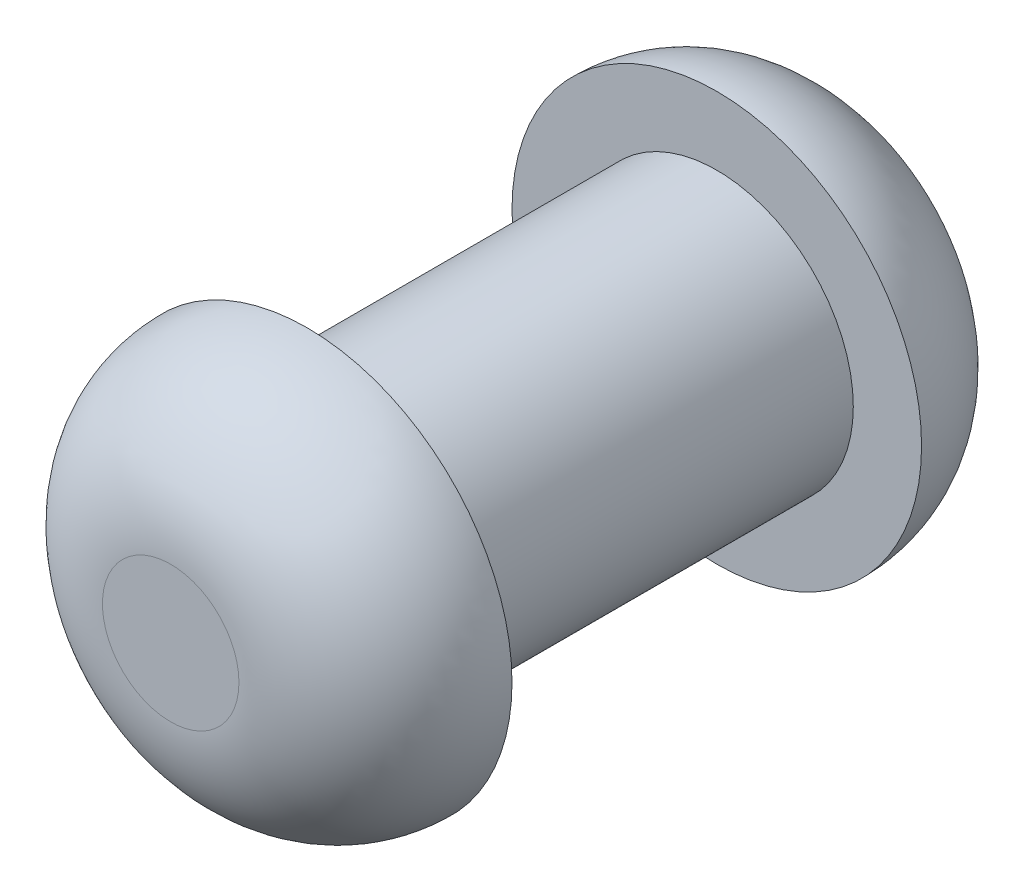
from build123d import *

# Parameters (mm, degrees)
IZIM1_R                     = 5
Y_KSEKLIK_EKSTR_ZYON1_DEPTH = 15
IZIM2_R                     = 7.5
Y_KSEKLIK_EKSTR_ZYON2_DEPTH = 5
RADYUS1_R                   = 5
Y_KSEKLIK_EKSTR_ZYON3_START = 5
IZIM3_R                     = 7.5
Y_KSEKLIK_EKSTR_ZYON3_DEPTH = 5
RADYUS2_R                   = 5


with BuildPart() as part:
    # Çizim1 → Yükseklik-Ekstrüzyon1 (new body)
    with BuildSketch(Plane.XY):
        Circle(IZIM1_R)
    extrude(amount=Y_KSEKLIK_EKSTR_ZYON1_DEPTH)

    # Çizim2 → Yükseklik-Ekstrüzyon2 (add)
    with BuildSketch(Plane.XY.offset(15)):
        Circle(IZIM2_R)
    extrude(amount=Y_KSEKLIK_EKSTR_ZYON2_DEPTH)

    # Radyus1
    radyus1_edges = [part.edges().sort_by_distance(p)[0] for p in [
        (-7.5, 0, 20),
    ]]
    fillet(radyus1_edges, radius=RADYUS1_R - 0.0001)  # a hair under: the kernel refuses the full size

    # Çizim3 → Yükseklik-Ekstrüzyon3 (add)
    with BuildSketch(Plane(origin=(0, 0, 0), x_dir=(-1, 0, 0), z_dir=(0, 0, -1)).offset(Y_KSEKLIK_EKSTR_ZYON3_START)):
        Circle(IZIM3_R)
    extrude(amount=-Y_KSEKLIK_EKSTR_ZYON3_DEPTH)

    # Radyus2
    radyus2_edges = [part.edges().sort_by_distance(p)[0] for p in [
        (7.5, 0, -5),
    ]]
    fillet(radyus2_edges, radius=RADYUS2_R - 0.0001)  # a hair under: the kernel refuses the full size


solid = part.part
